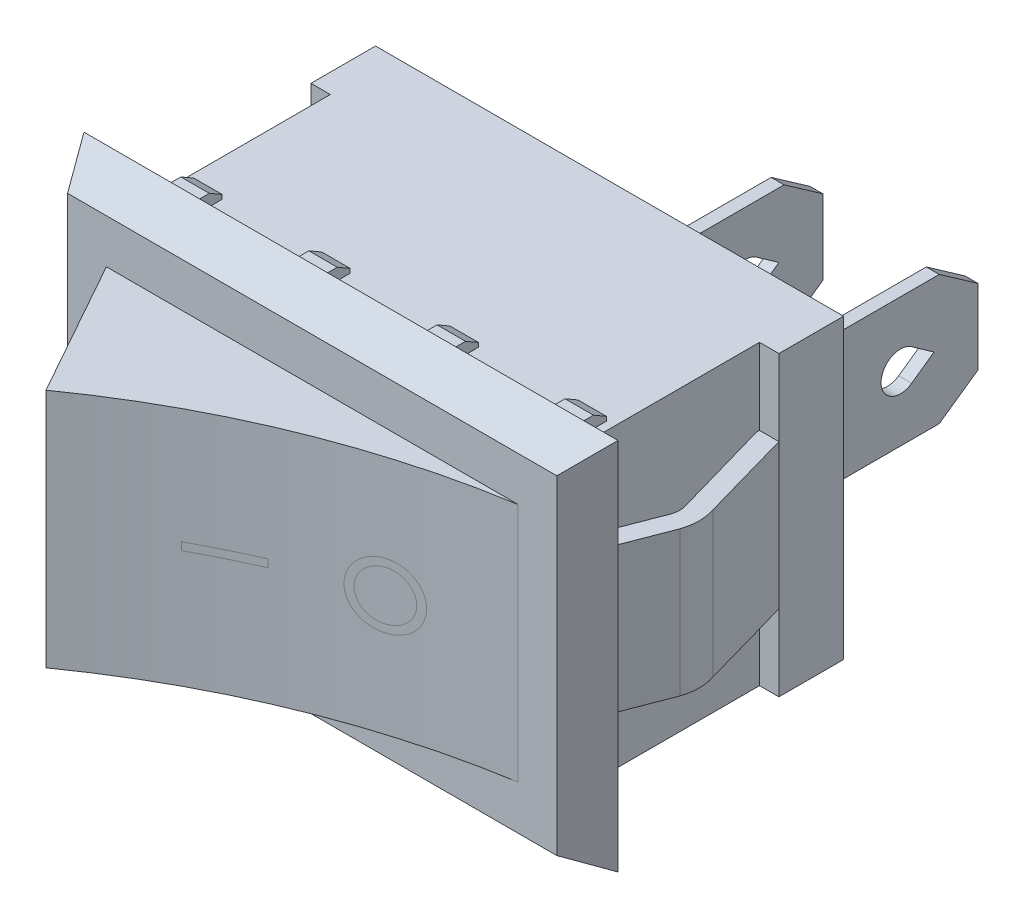
from build123d import *
from OCP.BRepFilletAPI import BRepFilletAPI_MakeChamfer

# Parameters (mm, degrees)
SKETCH1_W                       = 16.6
SKETCH1_H                       = 11.5
BOSS_EXTRUDE1_DEPTH             = 10
SKETCH2_W                       = 21
SKETCH2_H                       = 14.8
BOSS_EXTRUDE2_DEPTH             = 1.5
SKETCH3_W                       = 0.5
SKETCH3_H                       = 5
BOSS_EXTRUDE3_DEPTH             = 8
SKETCH4_W                       = 0.5
SKETCH4_H                       = 0.4
CUT_EXTRUDE1_DEPTH              = 22.623424798
BOSS_EXTRUDE4_REACH             = 19.241
SKETCH5_W                       = 0.75
SKETCH5_H                       = 2.5
BOSS_EXTRUDE4_DIRECTION_2_REACH = 19.241
BOSS_EXTRUDE5_DEPTH             = 2.8
CHAMFER1_SIZE                   = 1.8
CHAMFER1_SIZE_2                 = 1.039230485
BOSS_EXTRUDE6_DEPTH             = 4.65
SKETCH8_W                       = 1.1
SKETCH8_H                       = 0.45
BOSS_EXTRUDE7_DEPTH             = 1.9
CHAMFER2_SIZE                   = 0.5
CHAMFER2_SIZE2                  = 0.288675135


with BuildPart() as part:
    # Sketch1 → Boss-Extrude1 (new body)
    with BuildSketch(Plane.XY):
        Rectangle(SKETCH1_W, SKETCH1_H)
    extrude(amount=BOSS_EXTRUDE1_DEPTH)

    # Sketch2 → Boss-Extrude2 (add)
    with BuildSketch(Plane.XY.offset(10)):
        Rectangle(SKETCH2_W, SKETCH2_H)
    extrude(amount=BOSS_EXTRUDE2_DEPTH)

    # Sketch3 → Boss-Extrude3 (add)
    with BuildSketch(Plane(origin=(0, 0, 0), x_dir=(-1, 0, 0), z_dir=(0, 0, -1))):
        Rectangle(SKETCH3_W, SKETCH3_H)
        with Locations((-6, 0)):
            Rectangle(SKETCH3_W, SKETCH3_H)
    extrude(amount=BOSS_EXTRUDE3_DEPTH)

    # Sketch4 → Cut-Extrude1 (cut, through all)
    with BuildSketch(Plane(origin=(6.25, 0, 0), x_dir=(0, 0, -1), z_dir=(1, 0, 0))):
        Polygon((6.5, 2.5), (8, 1.449688693), (8, 2.5), align=None)
        Polygon((8, -2.5), (8, -1.449688693), (6.5, -2.5), align=None)
        with Locations((2.25, -2.3)):
            Rectangle(SKETCH4_W, SKETCH4_H)
        with BuildLine():
            ThreePointArc((0, -0.75), (0.530330086, -0.530330086), (0.75, 0))
            Line((0.75, 0), (0, 0))
            Line((0, 0), (0, -0.75))
        make_face()
        with BuildLine():
            Line((0, 0), (0.75, 0))
            ThreePointArc((0.75, 0), (0.530330086, 0.530330086), (0, 0.75))
            Line((0, 0.75), (0, 0))
        make_face()
        with Locations((2.25, 2.3)):
            Rectangle(SKETCH4_W, SKETCH4_H)
        with BuildLine():
            Line((4.25, 0), (6.3, 0))
            Line((6.3, 0), (5.432692308, 0.612598863))
            ThreePointArc((5.432692308, 0.612598863), (4.655050171, 0.665965176), (4.25, 0))
        make_face()
        with BuildLine():
            Line((5.432692308, -0.612598863), (6.3, 0))
            Line((6.3, 0), (4.25, 0))
            ThreePointArc((4.25, 0), (4.655050171, -0.665965176), (5.432692308, -0.612598863))
        make_face()
    extrude(amount=-CUT_EXTRUDE1_DEPTH, mode=Mode.SUBTRACT)

    # Boss-Extrude4: up to this face of the body (flat: up to its plane)
    boss_extrude4_end = Plane(part.part.faces().sort_by_distance((0, 5.75, 5))[0])
    # Sketch5 → Boss-Extrude4 (add, up to the picked face)
    with BuildSketch(Plane(origin=(0, 0, 0), x_dir=(1, 0, 0), z_dir=(0, 1, 0)), mode=Mode.PRIVATE) as boss_extrude4_sk1:
        with Locations((-8.675, -1.25)):
            Rectangle(SKETCH5_W, SKETCH5_H)
    boss_extrude4_tool1 = split(extrude(boss_extrude4_sk1.sketch, amount=BOSS_EXTRUDE4_REACH, mode=Mode.PRIVATE), bisect_by=boss_extrude4_end, keep=Keep.BOTH, mode=Mode.PRIVATE)
    boss_extrude4 = boss_extrude4_tool1.solids().sort_by(Axis((-8.675, 0, 1.25), (0, 1, 0)))[0]
    add(boss_extrude4)

    # Boss-Extrude4 direction 2: up to this face of the body (flat: up to its plane)
    boss_extrude4_direction_2_end = Plane(part.part.faces().sort_by_distance((0, -5.75, 5))[0])
    # Sketch5 → Boss-Extrude4 direction 2 (add, up to the picked face)
    with BuildSketch(Plane(origin=(0, 0, 0), x_dir=(1, 0, 0), z_dir=(0, 1, 0)), mode=Mode.PRIVATE) as boss_extrude4_direction_2_sk1:
        with Locations((-8.675, -1.25)):
            Rectangle(SKETCH5_W, SKETCH5_H)
    boss_extrude4_direction_2_tool1 = split(extrude(boss_extrude4_direction_2_sk1.sketch, amount=-BOSS_EXTRUDE4_DIRECTION_2_REACH, mode=Mode.PRIVATE), bisect_by=boss_extrude4_direction_2_end, keep=Keep.BOTH, mode=Mode.PRIVATE)
    boss_extrude4_direction_2 = boss_extrude4_direction_2_tool1.solids().sort_by(Axis((-8.675, 0, 1.25), (0, -1, 0)))[0]
    add(boss_extrude4_direction_2)

    # Mirror1: Boss-Extrude4, Boss-Extrude4 direction 2 across plane
    add(boss_extrude4.mirror(Plane(origin=(0, 0, 0), x_dir=(0, 0, 1), z_dir=(1, 0, 0))))
    add(boss_extrude4_direction_2.mirror(Plane(origin=(0, 0, 0), x_dir=(0, 0, 1), z_dir=(1, 0, 0))))

    # Sketch6 → Boss-Extrude5 (add, symmetric)
    with BuildSketch(Plane(origin=(0, 0, 0), x_dir=(1, 0, 0), z_dir=(0, 1, 0))):
        with BuildLine():
            Line((-8.3, -2.5), (-9.05, -2.5))
            Line((-9.05, -2.5), (-10.056775734, -6.054415838))
            ThreePointArc((-10.056775734, -6.054415838), (-10.16130334, -6.692525863), (-10.056775734, -7.330635888))
            Line((-10.056775734, -7.330635888), (-9.03, -10))
            Line((-9.03, -10), (-8.3, -10))
            Line((-8.3, -10), (-8.3, -9.83))
            Line((-8.3, -9.83), (-9.324133061, -7.167955242))
            ThreePointArc((-9.324133061, -7.167955242), (-9.430562185, -6.777402526), (-9.37345004, -6.376657238))
            Line((-9.37345004, -6.376657238), (-8.3, -2.62))
            Line((-8.3, -2.62), (-8.3, -2.5))
        make_face()
    boss_extrude5 = extrude(amount=BOSS_EXTRUDE5_DEPTH, both=True)

    # Mirror2: Boss-Extrude5 across plane
    add(boss_extrude5.mirror(Plane(origin=(0, 0, 0), x_dir=(0, 0, 1), z_dir=(1, 0, 0))))

    # Chamfer1
    # the kernel refuses this chamfer: 1.8, 1.039230485 mm, written as the material it takes off along each edge
    with BuildSketch(Plane(origin=(-15.156754358, 7.4, 11.5), x_dir=(0, 0.019326765612700948, -0.9998132206222079), z_dir=(1, 0, 0))) as chamfer1_piece_1:
        Polygon((CHAMFER1_SIZE * 0.999813220622, -CHAMFER1_SIZE * 0.0193267656127), (-CHAMFER1_SIZE_2 * 0.0193267656042, -CHAMFER1_SIZE_2 * 0.999813220181), (0, 0), align=None)
    extrude(amount=30.313508717, mode=Mode.SUBTRACT)
    with BuildSketch(Plane(origin=(-10.5, -12.056754358, 11.5), x_dir=(-0.019326765612700473, 0, -0.9998132206222079), z_dir=(0, 1, 0)), Plane(origin=(10.5, 12.056754358, 11.5), x_dir=(0.019326765612700473, 0, -0.9998132206222079), z_dir=(0, -1, 0))) as chamfer1_piece_2:
        Polygon((CHAMFER1_SIZE * 0.999813220622, -CHAMFER1_SIZE * 0.0193267656127), (-CHAMFER1_SIZE_2 * 0.0193267656042, -CHAMFER1_SIZE_2 * 0.999813220181), (0, 0), align=None)
    extrude(amount=24.113508717, mode=Mode.SUBTRACT)
    with BuildSketch(Plane(origin=(15.156754358, -7.4, 11.5), x_dir=(0, 0.9983227437537925, 0.05789386240267112), z_dir=(-1, 0, 0))) as chamfer1_piece_3:
        Polygon((CHAMFER1_SIZE_2 * 0.998322743313, CHAMFER1_SIZE_2 * 0.0578938623771), (-CHAMFER1_SIZE * 0.0578938624027, CHAMFER1_SIZE * 0.998322743754), (0, 0), align=None)
    extrude(amount=30.313508717, mode=Mode.SUBTRACT)

    # Sketch7 → Boss-Extrude6 (add, symmetric)
    with BuildSketch(Plane(origin=(0, 0, 0), x_dir=(1, 0, 0), z_dir=(0, 1, 0))):
        with BuildLine():
            Line((-7.960769515, -11.5), (7.960769515, -11.5))
            ThreePointArc((7.960769515, -11.5), (1.177888648, -13.404715365), (-4.995235012, -16.8))
            Line((-4.995235012, -16.8), (-7.960769515, -11.5))
        make_face()
    extrude(amount=BOSS_EXTRUDE6_DEPTH, both=True)

    # Sketch8 → Boss-Extrude7 (add)
    with BuildSketch(Plane(origin=(0, 0, 10), x_dir=(-1, 0, 0), z_dir=(0, 0, -1))):
        with Locations((-2.48, 5.975)):
            Rectangle(SKETCH8_W, SKETCH8_H)
        with Locations((-2.48, -5.975)):
            Rectangle(SKETCH8_W, SKETCH8_H)
        with Locations((-7.43, 5.975)):
            Rectangle(SKETCH8_W, SKETCH8_H)
        with Locations((-7.43, -5.975)):
            Rectangle(SKETCH8_W, SKETCH8_H)
        with Locations((2.48, -5.975)):
            Rectangle(SKETCH8_W, SKETCH8_H)
        with Locations((7.43, -5.975)):
            Rectangle(SKETCH8_W, SKETCH8_H)
        with Locations((2.48, 5.975)):
            Rectangle(SKETCH8_W, SKETCH8_H)
        with Locations((7.43, 5.975)):
            Rectangle(SKETCH8_W, SKETCH8_H)
    extrude(amount=BOSS_EXTRUDE7_DEPTH)

    # Chamfer2: one chamfer whose edges measure the first distance from different faces: ONE call of the kernel's chamfer builder (chamfer() names one face for all edges)
    chamfer2_edges_1 = [part.edges().sort_by_distance(p)[0] for p in [
        (2.48, 6.2, 8.1),
    ]]
    chamfer2_side_1 = [part.faces().sort_by_distance(p)[0] for p in [
        (2.48, 6.2, 9.05),
    ]]
    chamfer2_edges_2 = [part.edges().sort_by_distance(p)[0] for p in [
        (7.43, 6.2, 8.1),
    ]]
    chamfer2_side_2 = [part.faces().sort_by_distance(p)[0] for p in [
        (7.43, 6.2, 9.05),
    ]]
    chamfer2_edges_3 = [part.edges().sort_by_distance(p)[0] for p in [
        (2.48, -6.2, 8.1),
    ]]
    chamfer2_side_3 = [part.faces().sort_by_distance(p)[0] for p in [
        (2.48, -6.2, 9.05),
    ]]
    chamfer2_edges_4 = [part.edges().sort_by_distance(p)[0] for p in [
        (7.43, -6.2, 8.1),
    ]]
    chamfer2_side_4 = [part.faces().sort_by_distance(p)[0] for p in [
        (7.43, -6.2, 9.05),
    ]]
    chamfer2_edges_5 = [part.edges().sort_by_distance(p)[0] for p in [
        (-2.48, -6.2, 8.1),
    ]]
    chamfer2_side_5 = [part.faces().sort_by_distance(p)[0] for p in [
        (-2.48, -6.2, 9.05),
    ]]
    chamfer2_edges_6 = [part.edges().sort_by_distance(p)[0] for p in [
        (-7.43, -6.2, 8.1),
    ]]
    chamfer2_side_6 = [part.faces().sort_by_distance(p)[0] for p in [
        (-7.43, -6.2, 9.05),
    ]]
    chamfer2_edges_7 = [part.edges().sort_by_distance(p)[0] for p in [
        (-2.48, 6.2, 8.1),
    ]]
    chamfer2_side_7 = [part.faces().sort_by_distance(p)[0] for p in [
        (-2.48, 6.2, 9.05),
    ]]
    chamfer2_edges_8 = [part.edges().sort_by_distance(p)[0] for p in [
        (-7.43, 6.2, 8.1),
    ]]
    chamfer2_side_8 = [part.faces().sort_by_distance(p)[0] for p in [
        (-7.43, 6.2, 9.05),
    ]]
    chamfer2 = BRepFilletAPI_MakeChamfer(part.part.solid().wrapped)
    for e in chamfer2_edges_1:
        chamfer2.Add(CHAMFER2_SIZE, CHAMFER2_SIZE2, e.wrapped, chamfer2_side_1[0].wrapped)  # the first distance lies on this face
    for e in chamfer2_edges_2:
        chamfer2.Add(CHAMFER2_SIZE, CHAMFER2_SIZE2, e.wrapped, chamfer2_side_2[0].wrapped)  # the first distance lies on this face
    for e in chamfer2_edges_3:
        chamfer2.Add(CHAMFER2_SIZE, CHAMFER2_SIZE2, e.wrapped, chamfer2_side_3[0].wrapped)  # the first distance lies on this face
    for e in chamfer2_edges_4:
        chamfer2.Add(CHAMFER2_SIZE, CHAMFER2_SIZE2, e.wrapped, chamfer2_side_4[0].wrapped)  # the first distance lies on this face
    for e in chamfer2_edges_5:
        chamfer2.Add(CHAMFER2_SIZE, CHAMFER2_SIZE2, e.wrapped, chamfer2_side_5[0].wrapped)  # the first distance lies on this face
    for e in chamfer2_edges_6:
        chamfer2.Add(CHAMFER2_SIZE, CHAMFER2_SIZE2, e.wrapped, chamfer2_side_6[0].wrapped)  # the first distance lies on this face
    for e in chamfer2_edges_7:
        chamfer2.Add(CHAMFER2_SIZE, CHAMFER2_SIZE2, e.wrapped, chamfer2_side_7[0].wrapped)  # the first distance lies on this face
    for e in chamfer2_edges_8:
        chamfer2.Add(CHAMFER2_SIZE, CHAMFER2_SIZE2, e.wrapped, chamfer2_side_8[0].wrapped)  # the first distance lies on this face
    add(Compound.cast(chamfer2.Shape()), mode=Mode.REPLACE)


solid = part.part
